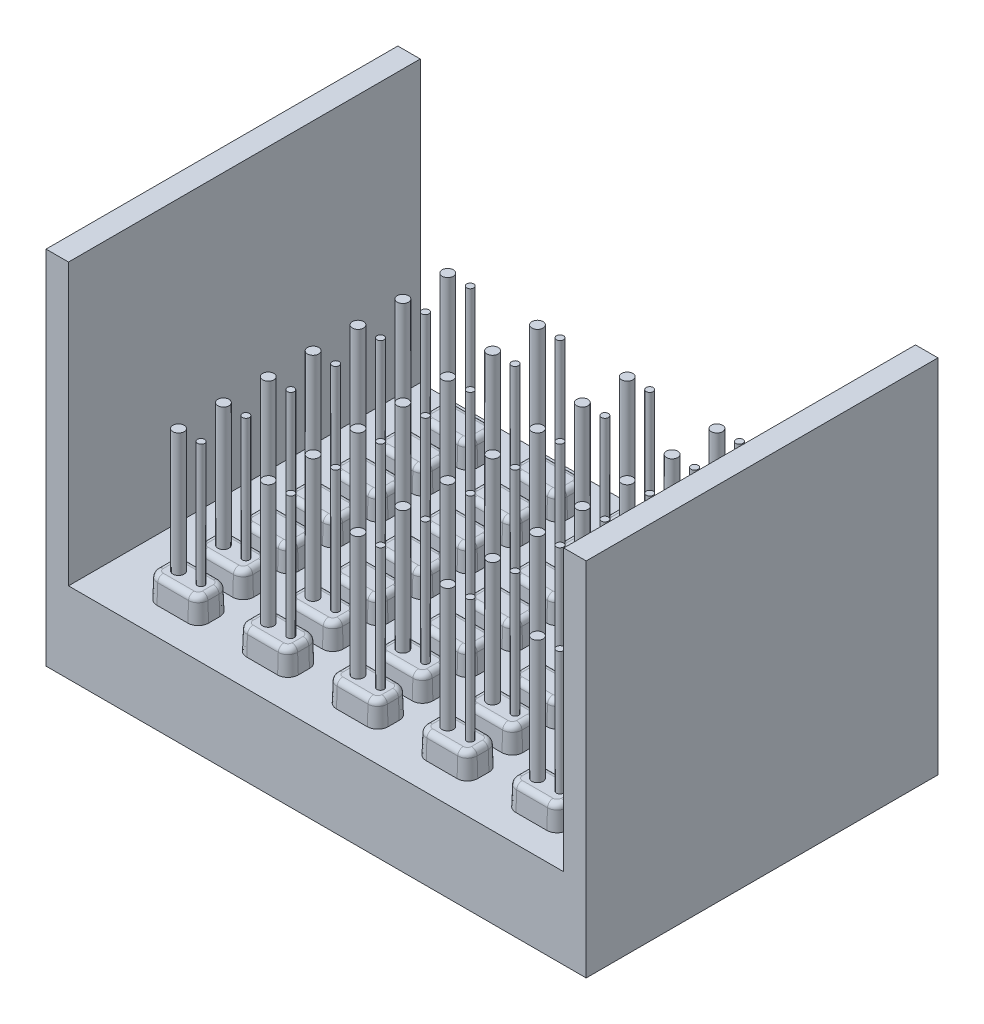
from build123d import *

# Parameters (mm, degrees)
EXTRUDE1_DEPTH       = 2.2
EXTRUDE1_DEPTH_BACK  = 5
SKETCH3_W            = 6.699989888
SKETCH3_H            = 31.358053578
LPATTERN2_COUNT      = 6
LPATTERN2_PITCH      = 6.69
EXTRUDE2_DEPTH       = 4.4
EXTRUDE2_TAPER       = 2
SKETCH11_R           = 0.315
SKETCH11_R_2         = 0.5
EXTRUDE8_DEPTH       = 11
LPATTERN3_COUNT      = 7
LPATTERN3_PITCH      = 4
LPATTERN3_COUNT_DIR2 = 5
LPATTERN3_PITCH_DIR2 = 8
SKETCH6_W            = 31.358053578
SKETCH6_H            = 7.2
EXTRUDE4_DEPTH       = 4
SKETCH8_W            = 31.358053578
SKETCH8_H            = 7.2
EXTRUDE5_DEPTH       = 4
SKETCH9_W            = 2
SKETCH9_H            = 31.358053578
EXTRUDE6_DEPTH       = 25
FILLET2_R            = 0.5


with BuildPart() as part:
    # Sketch3 → Extrude1 (new, two sides: drawn at the far end of the back side and taken through both)
    with BuildSketch(Plane(origin=(0, 0, 0), x_dir=(1, 0, 0), z_dir=(0, 1, 0)).offset(-EXTRUDE1_DEPTH_BACK)):
        with Locations((2.34594374, -12.933956357)):
            Rectangle(SKETCH3_W, SKETCH3_H)
    extrude(amount=EXTRUDE1_DEPTH + EXTRUDE1_DEPTH_BACK)


with BuildPart() as lpattern2_1:
    # LPattern2: pattern copy
    add(part.part.moved(Location(Vector(-1, 0, 0) * (1 * LPATTERN2_PITCH))))


with BuildPart() as lpattern2_2:
    # LPattern2: pattern copy
    add(part.part.moved(Location(Vector(-1, 0, 0) * (2 * LPATTERN2_PITCH))))


with BuildPart() as lpattern2_3:
    # LPattern2: pattern copy
    add(part.part.moved(Location(Vector(-1, 0, 0) * (3 * LPATTERN2_PITCH))))


with BuildPart() as lpattern2_4:
    # LPattern2: pattern copy
    add(part.part.moved(Location(Vector(-1, 0, 0) * (4 * LPATTERN2_PITCH))))


with BuildPart() as lpattern2_5:
    # LPattern2: pattern copy
    add(part.part.moved(Location(Vector(-1, 0, 0) * (5 * LPATTERN2_PITCH))))


with BuildPart() as lpattern2_1_1:
    add(lpattern2_1.part)

    # Combine2: read off the stored shape, not the designer's step
    # Combine2: union LPattern2_5, LPattern2_4, LPattern2_3, LPattern2_2, part
    add(lpattern2_5.part)
    add(lpattern2_4.part)
    add(lpattern2_3.part)
    add(lpattern2_2.part)
    add(part.part)

    # Sketch4 → Extrude2 (add)
    with BuildSketch(Plane(origin=(0, 0, 0), x_dir=(1, 0, 0), z_dir=(0, 1, 0))):
        with BuildLine():
            Line((0.995948796, -2.248569651), (3.745938684, -2.248569651))
            ThreePointArc((3.745938684, -2.248569651), (4.453045465, -1.955676432), (4.745938684, -1.248569651))
            Line((4.745938684, -1.248569651), (4.745938684, -0.254929568))
            ThreePointArc((4.745938684, -0.254929568), (4.453045465, 0.452177214), (3.745938684, 0.745070432))
            Line((3.745938684, 0.745070432), (0.995948796, 0.745070432))
            ThreePointArc((0.995948796, 0.745070432), (0.288842015, 0.452177214), (-0.004051204, -0.254929568))
            Line((-0.004051204, -0.254929568), (-0.004051204, -1.248569651))
            ThreePointArc((-0.004051204, -1.248569651), (0.288842015, -1.955676432), (0.995948796, -2.248569651))
        make_face()
    extrude2 = extrude(amount=EXTRUDE2_DEPTH, taper=EXTRUDE2_TAPER)

    # Sketch11 → Extrude8 (add)
    with BuildSketch(Plane(origin=(0, 4.4, 0), x_dir=(-1, 0, 0), z_dir=(0, 1, 0))):
        with Locations(Location((-3.495938684, 0.748569651, 0), (0, 0, 90))):
            Circle(SKETCH11_R)
        with Locations(Location((-1.495948796, 0.754929568, 0), (0, 0, 90))):
            Circle(SKETCH11_R_2)
    extrude8 = extrude(amount=EXTRUDE8_DEPTH)

    # LPattern3: Extrude2, Extrude8 7 × 5
    with Locations(*[(-j * LPATTERN3_PITCH_DIR2, 0, i * LPATTERN3_PITCH) for i in range(LPATTERN3_COUNT) for j in range(LPATTERN3_COUNT_DIR2) if (i, j) != (0, 0)]):
        add(extrude2)
        add(extrude8)

    # Sketch6 → Extrude4 (add)
    with BuildSketch(Plane(origin=(5.695938684, 0, 0), x_dir=(0, 0, -1), z_dir=(1, 0, 0))):
        with Locations((-12.933956357, -1.4)):
            Rectangle(SKETCH6_W, SKETCH6_H)
    extrude(amount=EXTRUDE4_DEPTH)

    # Sketch8 → Extrude5 (add)
    with BuildSketch(Plane.ZY.offset(34.454051204)):
        with Locations((12.933956357, -1.4)):
            Rectangle(SKETCH8_W, SKETCH8_H)
    extrude(amount=EXTRUDE5_DEPTH)

    # Sketch9 → Extrude6 (add)
    with BuildSketch(Plane(origin=(0, 2.2, 0), x_dir=(-1, 0, 0), z_dir=(0, 1, 0))):
        with Locations((-8.695938684, 12.933956357)):
            Rectangle(SKETCH9_W, SKETCH9_H)
        with Locations((37.454051204, 12.933956357)):
            Rectangle(SKETCH9_W, SKETCH9_H)
    extrude(amount=EXTRUDE6_DEPTH)

    # Fillet2
    fillet2_edges = [lpattern2_1_1.edges().sort_by_distance(p)[0] for p in [
        (0.397489952, 4.4, 9.847028495),
        (2.37094374, 4.4, 10.094918265),
        (4.344397528, 4.4, 9.847028495),
        (4.592287298, 4.4, 8.751749609),
        (4.344397528, 4.4, 7.656470723),
        (2.37094374, 4.4, 7.408580953),
        (0.397489952, 4.4, 7.656470723),
        (0.149600182, 4.4, 8.751749609),
        (0.397489952, 4.4, 13.847028495),
        (2.37094374, 4.4, 14.094918265),
        (4.344397528, 4.4, 13.847028495),
        (4.592287298, 4.4, 12.751749609),
        (4.344397528, 4.4, 11.656470723),
        (2.37094374, 4.4, 11.408580953),
        (0.397489952, 4.4, 11.656470723),
        (0.149600182, 4.4, 12.751749609),
        (0.397489952, 4.4, 17.847028495),
        (2.37094374, 4.4, 18.094918265),
        (4.344397528, 4.4, 17.847028495),
        (4.592287298, 4.4, 16.751749609),
        (4.344397528, 4.4, 15.656470723),
        (2.37094374, 4.4, 15.408580953),
        (0.397489952, 4.4, 15.656470723),
        (0.149600182, 4.4, 16.751749609),
        (0.397489952, 4.4, 21.847028495),
        (2.37094374, 4.4, 22.094918265),
        (4.344397528, 4.4, 21.847028495),
        (4.592287298, 4.4, 20.751749609),
        (4.344397528, 4.4, 19.656470723),
        (2.37094374, 4.4, 19.408580953),
        (0.397489952, 4.4, 19.656470723),
        (0.149600182, 4.4, 20.751749609),
        (0.397489952, 4.4, 25.847028495),
        (2.37094374, 4.4, 26.094918265),
        (4.344397528, 4.4, 25.847028495),
        (4.592287298, 4.4, 24.751749609),
        (4.344397528, 4.4, 23.656470723),
        (2.37094374, 4.4, 23.408580953),
        (0.397489952, 4.4, 23.656470723),
        (0.149600182, 4.4, 24.751749609),
        (-7.602510048, 4.4, 1.847028495),
        (-5.62905626, 4.4, 2.094918265),
        (-3.655602472, 4.4, 1.847028495),
        (-3.407712702, 4.4, 0.751749609),
        (-3.655602472, 4.4, -0.343529277),
        (-5.62905626, 4.4, -0.591419047),
        (-7.602510048, 4.4, -0.343529277),
        (-7.850399818, 4.4, 0.751749609),
        (-7.602510048, 4.4, 5.847028495),
        (-5.62905626, 4.4, 6.094918265),
        (-3.655602472, 4.4, 5.847028495),
        (-3.407712702, 4.4, 4.751749609),
        (-3.655602472, 4.4, 3.656470723),
        (-5.62905626, 4.4, 3.408580953),
        (-7.602510048, 4.4, 3.656470723),
        (-7.850399818, 4.4, 4.751749609),
        (-7.602510048, 4.4, 9.847028495),
        (-5.62905626, 4.4, 10.094918265),
        (-3.655602472, 4.4, 9.847028495),
        (-3.407712702, 4.4, 8.751749609),
        (-3.655602472, 4.4, 7.656470723),
        (-5.62905626, 4.4, 7.408580953),
        (-7.602510048, 4.4, 7.656470723),
        (-7.850399818, 4.4, 8.751749609),
        (-7.602510048, 4.4, 13.847028495),
        (-5.62905626, 4.4, 14.094918265),
        (-3.655602472, 4.4, 13.847028495),
        (-3.407712702, 4.4, 12.751749609),
        (-3.655602472, 4.4, 11.656470723),
        (-5.62905626, 4.4, 11.408580953),
        (-7.602510048, 4.4, 11.656470723),
        (-7.850399818, 4.4, 12.751749609),
        (-7.602510048, 4.4, 17.847028495),
        (-5.62905626, 4.4, 18.094918265),
        (-3.655602472, 4.4, 17.847028495),
        (-3.407712702, 4.4, 16.751749609),
        (-3.655602472, 4.4, 15.656470723),
        (-5.62905626, 4.4, 15.408580953),
        (-7.602510048, 4.4, 15.656470723),
        (-7.850399818, 4.4, 16.751749609),
        (-7.602510048, 4.4, 21.847028495),
        (-5.62905626, 4.4, 22.094918265),
        (-3.655602472, 4.4, 21.847028495),
        (-3.407712702, 4.4, 20.751749609),
        (-3.655602472, 4.4, 19.656470723),
        (-5.62905626, 4.4, 19.408580953),
        (-7.602510048, 4.4, 19.656470723),
        (-7.850399818, 4.4, 20.751749609),
        (-7.602510048, 4.4, 25.847028495),
        (-5.62905626, 4.4, 26.094918265),
        (-3.655602472, 4.4, 25.847028495),
        (-3.407712702, 4.4, 24.751749609),
        (-3.655602472, 4.4, 23.656470723),
        (-5.62905626, 4.4, 23.408580953),
        (-7.602510048, 4.4, 23.656470723),
        (-7.850399818, 4.4, 24.751749609),
        (-15.602510048, 4.4, 1.847028495),
        (-13.62905626, 4.4, 2.094918265),
        (-11.655602472, 4.4, 1.847028495),
        (-11.407712702, 4.4, 0.751749609),
        (-11.655602472, 4.4, -0.343529277),
        (-13.62905626, 4.4, -0.591419047),
        (-15.602510048, 4.4, -0.343529277),
        (-15.850399818, 4.4, 0.751749609),
        (-15.602510048, 4.4, 5.847028495),
        (-13.62905626, 4.4, 6.094918265),
        (-11.655602472, 4.4, 5.847028495),
        (-11.407712702, 4.4, 4.751749609),
        (-11.655602472, 4.4, 3.656470723),
        (-13.62905626, 4.4, 3.408580953),
        (-15.602510048, 4.4, 3.656470723),
        (-15.850399818, 4.4, 4.751749609),
        (-15.602510048, 4.4, 9.847028495),
        (-13.62905626, 4.4, 10.094918265),
        (-11.655602472, 4.4, 9.847028495),
        (-11.407712702, 4.4, 8.751749609),
        (-11.655602472, 4.4, 7.656470723),
        (-13.62905626, 4.4, 7.408580953),
        (-15.602510048, 4.4, 7.656470723),
        (-15.850399818, 4.4, 8.751749609),
        (-15.602510048, 4.4, 13.847028495),
        (-13.62905626, 4.4, 14.094918265),
        (-11.655602472, 4.4, 13.847028495),
        (-11.407712702, 4.4, 12.751749609),
        (-11.655602472, 4.4, 11.656470723),
        (-13.62905626, 4.4, 11.408580953),
        (-15.602510048, 4.4, 11.656470723),
        (-15.850399818, 4.4, 12.751749609),
        (-15.602510048, 4.4, 17.847028495),
        (-13.62905626, 4.4, 18.094918265),
        (-11.655602472, 4.4, 17.847028495),
        (-11.407712702, 4.4, 16.751749609),
        (-11.655602472, 4.4, 15.656470723),
        (-13.62905626, 4.4, 15.408580953),
        (-15.602510048, 4.4, 15.656470723),
        (-15.850399818, 4.4, 16.751749609),
        (-15.602510048, 4.4, 21.847028495),
        (-13.62905626, 4.4, 22.094918265),
        (-11.655602472, 4.4, 21.847028495),
        (-11.407712702, 4.4, 20.751749609),
        (-11.655602472, 4.4, 19.656470723),
        (-13.62905626, 4.4, 19.408580953),
        (-15.602510048, 4.4, 19.656470723),
        (-15.850399818, 4.4, 20.751749609),
        (-15.602510048, 4.4, 25.847028495),
        (-13.62905626, 4.4, 26.094918265),
        (-11.655602472, 4.4, 25.847028495),
        (-11.407712702, 4.4, 24.751749609),
        (-11.655602472, 4.4, 23.656470723),
        (-13.62905626, 4.4, 23.408580953),
        (-15.602510048, 4.4, 23.656470723),
        (-15.850399818, 4.4, 24.751749609),
        (-23.602510048, 4.4, 1.847028495),
        (-21.62905626, 4.4, 2.094918265),
        (-19.655602472, 4.4, 1.847028495),
        (-19.407712702, 4.4, 0.751749609),
        (-19.655602472, 4.4, -0.343529277),
        (-21.62905626, 4.4, -0.591419047),
        (-23.602510048, 4.4, -0.343529277),
        (-23.850399818, 4.4, 0.751749609),
        (-23.602510048, 4.4, 5.847028495),
        (-21.62905626, 4.4, 6.094918265),
        (-19.655602472, 4.4, 5.847028495),
        (-19.407712702, 4.4, 4.751749609),
        (-19.655602472, 4.4, 3.656470723),
        (-21.62905626, 4.4, 3.408580953),
        (-23.602510048, 4.4, 3.656470723),
        (-23.850399818, 4.4, 4.751749609),
        (-23.602510048, 4.4, 9.847028495),
        (-21.62905626, 4.4, 10.094918265),
        (-19.655602472, 4.4, 9.847028495),
        (-19.407712702, 4.4, 8.751749609),
        (-19.655602472, 4.4, 7.656470723),
        (-21.62905626, 4.4, 7.408580953),
        (-23.602510048, 4.4, 7.656470723),
        (-23.850399818, 4.4, 8.751749609),
        (-23.602510048, 4.4, 13.847028495),
        (-21.62905626, 4.4, 14.094918265),
        (-19.655602472, 4.4, 13.847028495),
        (-19.407712702, 4.4, 12.751749609),
        (-19.655602472, 4.4, 11.656470723),
        (-21.62905626, 4.4, 11.408580953),
        (-23.602510048, 4.4, 11.656470723),
        (-23.850399818, 4.4, 12.751749609),
        (-23.602510048, 4.4, 17.847028495),
        (-21.62905626, 4.4, 18.094918265),
        (-19.655602472, 4.4, 17.847028495),
        (-19.407712702, 4.4, 16.751749609),
        (-19.655602472, 4.4, 15.656470723),
        (-21.62905626, 4.4, 15.408580953),
        (-23.602510048, 4.4, 15.656470723),
        (-23.850399818, 4.4, 16.751749609),
        (-23.602510048, 4.4, 21.847028495),
        (-21.62905626, 4.4, 22.094918265),
        (-19.655602472, 4.4, 21.847028495),
        (-19.407712702, 4.4, 20.751749609),
        (-19.655602472, 4.4, 19.656470723),
        (-21.62905626, 4.4, 19.408580953),
        (-23.602510048, 4.4, 19.656470723),
        (-23.850399818, 4.4, 20.751749609),
        (-23.602510048, 4.4, 25.847028495),
        (-21.62905626, 4.4, 26.094918265),
        (-19.655602472, 4.4, 25.847028495),
        (-19.407712702, 4.4, 24.751749609),
        (-19.655602472, 4.4, 23.656470723),
        (-21.62905626, 4.4, 23.408580953),
        (-23.602510048, 4.4, 23.656470723),
        (-23.850399818, 4.4, 24.751749609),
        (-31.602510048, 4.4, 1.847028495),
        (-29.62905626, 4.4, 2.094918265),
        (-27.655602472, 4.4, 1.847028495),
        (-27.407712702, 4.4, 0.751749609),
        (-27.655602472, 4.4, -0.343529277),
        (-29.62905626, 4.4, -0.591419047),
        (-31.602510048, 4.4, -0.343529277),
        (-31.850399818, 4.4, 0.751749609),
        (-31.602510048, 4.4, 5.847028495),
        (-29.62905626, 4.4, 6.094918265),
        (-27.655602472, 4.4, 5.847028495),
        (-27.407712702, 4.4, 4.751749609),
        (-27.655602472, 4.4, 3.656470723),
        (-29.62905626, 4.4, 3.408580953),
        (-31.602510048, 4.4, 3.656470723),
        (-31.850399818, 4.4, 4.751749609),
        (0.397489952, 4.4, 1.847028495),
        (2.37094374, 4.4, 2.094918265),
        (-31.602510048, 4.4, 9.847028495),
        (-29.62905626, 4.4, 10.094918265),
        (4.344397528, 4.4, 1.847028495),
        (-27.655602472, 4.4, 9.847028495),
        (-27.407712702, 4.4, 8.751749609),
        (-27.655602472, 4.4, 7.656470723),
        (-29.62905626, 4.4, 7.408580953),
        (-31.602510048, 4.4, 7.656470723),
        (-31.850399818, 4.4, 8.751749609),
        (4.592287298, 4.4, 0.751749609),
        (4.344397528, 4.4, -0.343529277),
        (2.37094374, 4.4, -0.591419047),
        (0.397489952, 4.4, -0.343529277),
        (-31.602510048, 4.4, 13.847028495),
        (-29.62905626, 4.4, 14.094918265),
        (0.149600182, 4.4, 0.751749609),
        (-27.655602472, 4.4, 13.847028495),
        (-27.407712702, 4.4, 12.751749609),
        (-27.655602472, 4.4, 11.656470723),
        (-29.62905626, 4.4, 11.408580953),
        (-31.602510048, 4.4, 11.656470723),
        (-31.850399818, 4.4, 12.751749609),
        (-31.602510048, 4.4, 17.847028495),
        (-29.62905626, 4.4, 18.094918265),
        (-27.655602472, 4.4, 17.847028495),
        (-27.407712702, 4.4, 16.751749609),
        (-27.655602472, 4.4, 15.656470723),
        (-29.62905626, 4.4, 15.408580953),
        (-31.602510048, 4.4, 15.656470723),
        (-31.850399818, 4.4, 16.751749609),
        (-31.602510048, 4.4, 21.847028495),
        (-29.62905626, 4.4, 22.094918265),
        (-27.655602472, 4.4, 21.847028495),
        (-27.407712702, 4.4, 20.751749609),
        (-27.655602472, 4.4, 19.656470723),
        (-29.62905626, 4.4, 19.408580953),
        (-31.602510048, 4.4, 19.656470723),
        (-31.850399818, 4.4, 20.751749609),
        (-31.602510048, 4.4, 25.847028495),
        (-29.62905626, 4.4, 26.094918265),
        (-27.655602472, 4.4, 25.847028495),
        (-27.407712702, 4.4, 24.751749609),
        (-27.655602472, 4.4, 23.656470723),
        (-29.62905626, 4.4, 23.408580953),
        (-31.602510048, 4.4, 23.656470723),
        (-31.850399818, 4.4, 24.751749609),
        (0.397489952, 4.4, 5.847028495),
        (2.37094374, 4.4, 6.094918265),
        (4.344397528, 4.4, 5.847028495),
        (4.592287298, 4.4, 4.751749609),
        (4.344397528, 4.4, 3.656470723),
        (2.37094374, 4.4, 3.408580953),
        (0.397489952, 4.4, 3.656470723),
        (0.149600182, 4.4, 4.751749609),
    ]]
    fillet(fillet2_edges, radius=FILLET2_R)


solid = lpattern2_1_1.part
